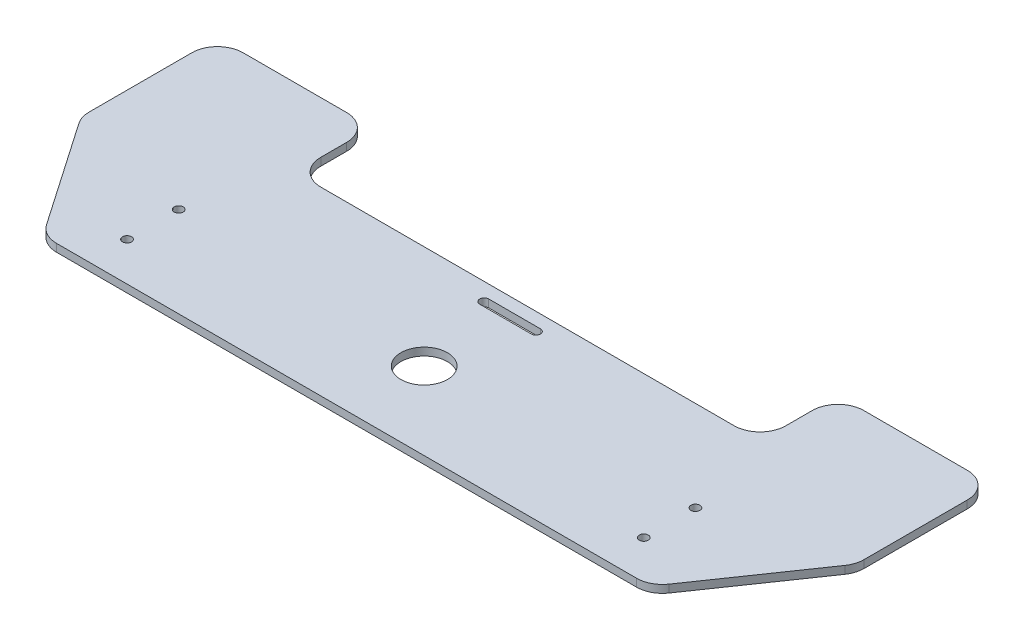
from build123d import *

# Parameters (mm, degrees)
EXTRUDE_1_DEPTH     = 3
SKETCH_2_R          = 1.75
CUT_EXTRUDE_1_DEPTH = 10
CUT_EXTRUDE_2_DEPTH = 3
SKETCH_4_R          = 9
CUT_EXTRUDE_3_DEPTH = 10


with BuildPart() as part:
    # 草图1 → 凸台-拉伸1 (new body)
    with BuildSketch(Plane(origin=(0, 0, 0), x_dir=(1, 0, 0), z_dir=(0, 1, 0))):
        with BuildLine():
            Line((-148.235829522, 19.513411872), (-120.492131082, -20.771152042))
            ThreePointArc((-120.492131082, -20.771152042), (-116.908205257, -23.951300285), (-112.25630156, -25.099193643))
            Line((-112.25630156, -25.099193643), (112.25630156, -25.099193643))
            ThreePointArc((112.25630156, -25.099193643), (116.908205257, -23.951300285), (120.492131082, -20.771152042))
            Line((120.492131082, -20.771152042), (148.235829522, 19.513411872))
            ThreePointArc((148.235829522, 19.513411872), (149.548777283, 22.215378286), (150, 25.185370271))
            Line((150, 25.185370271), (150, 65))
            ThreePointArc((150, 65), (147.169490918, 72.124628896), (140.101052961, 75.092675968))
            Line((140.101052961, 75.092675968), (100.001859318, 75.092675968))
            ThreePointArc((100.001859318, 75.092675968), (92.860872953, 72.096900105), (90, 64.900806357))
            Line((90, 64.900806357), (90, 54.900806357))
            ThreePointArc((90, 54.900806357), (87.071067812, 47.829738545), (80, 44.900806357))
            Line((80, 44.900806357), (-80, 44.900806357))
            ThreePointArc((-80, 44.900806357), (-87.071067812, 47.829738545), (-90, 54.900806357))
            Line((-90, 54.900806357), (-90, 64.900806357))
            ThreePointArc((-90, 64.900806357), (-92.928932188, 71.971874169), (-100, 74.900806357))
            Line((-100, 74.900806357), (-140.099193643, 74.900806357))
            ThreePointArc((-140.099193643, 74.900806357), (-147.100120957, 72.000927314), (-150, 65))
            Line((-150, 65), (-150, 25.185370271))
            ThreePointArc((-150, 25.185370271), (-149.548777283, 22.215378286), (-148.235829522, 19.513411872))
        make_face()
    extrude(amount=EXTRUDE_1_DEPTH)

    # 草图2 → 切除-拉伸1 (cut)
    with BuildSketch(Plane(origin=(0, 3, 0), x_dir=(1, 0, 0), z_dir=(0, 1, 0))):
        with Locations((100, 9.900806357)):
            Circle(SKETCH_2_R)
        with Locations((100, -10.099193643)):
            Circle(SKETCH_2_R)
        with Locations((-100, -10.099193643)):
            Circle(SKETCH_2_R)
        with Locations((-100, 9.900806357)):
            Circle(SKETCH_2_R)
    extrude(amount=-CUT_EXTRUDE_1_DEPTH, mode=Mode.SUBTRACT)

    # 草图3 → 切除-拉伸2 (cut)
    with BuildSketch(Plane(origin=(0, 3, 0), x_dir=(1, 0, 0), z_dir=(0, 1, 0))):
        with BuildLine():
            Line((-10, 39.900806357), (10, 39.900806357))
            ThreePointArc((10, 39.900806357), (11.75, 38.150806357), (10, 36.400806357))
            Line((10, 36.400806357), (-10, 36.400806357))
            ThreePointArc((-10, 36.400806357), (-11.75, 38.150806357), (-10, 39.900806357))
        make_face()
    extrude(amount=-CUT_EXTRUDE_2_DEPTH, mode=Mode.SUBTRACT)

    # 草图4 → 切除-拉伸3 (cut)
    with BuildSketch(Plane(origin=(0, 3, 0), x_dir=(1, 0, 0), z_dir=(0, 1, 0))):
        with Locations((0, 4.900806357)):
            Circle(SKETCH_4_R)
    extrude(amount=-CUT_EXTRUDE_3_DEPTH, mode=Mode.SUBTRACT)


solid = part.part
